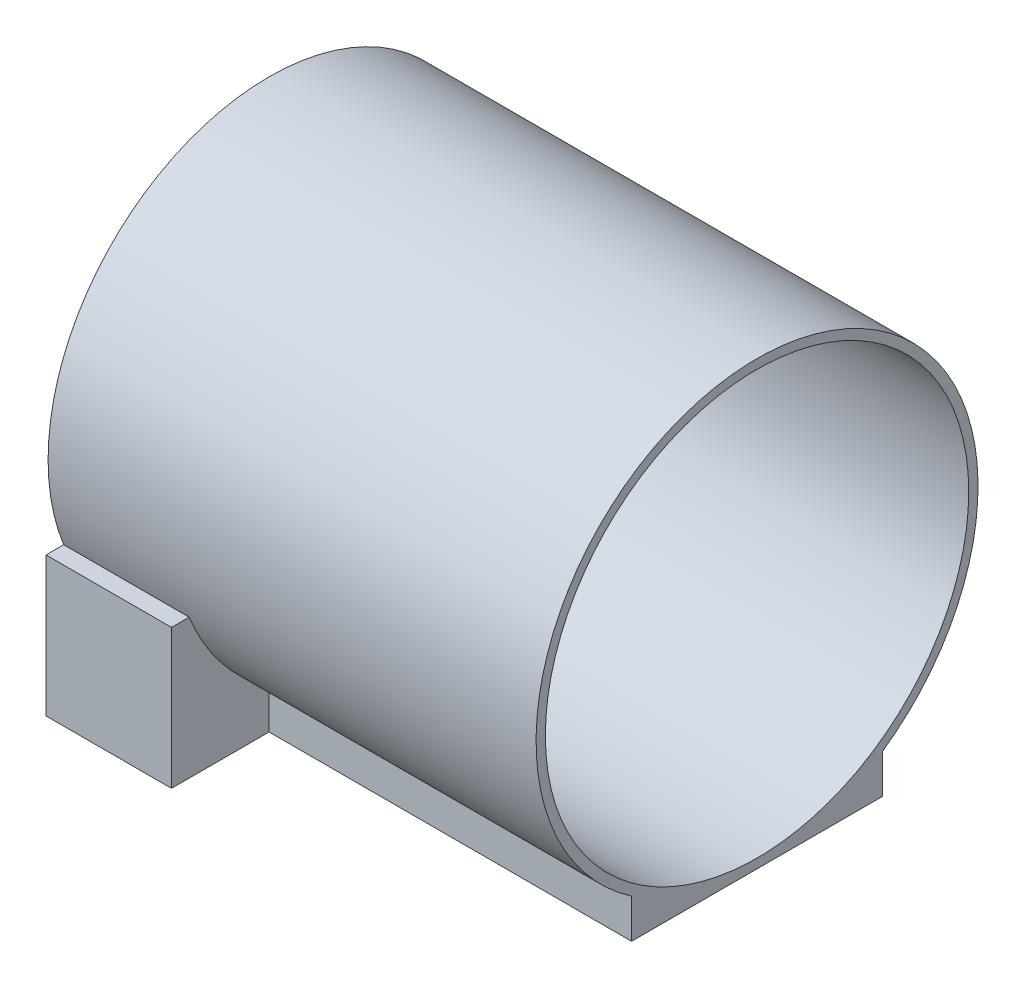
from build123d import *

# Parameters (mm, degrees)
SKETCH2_W                = 10
SKETCH2_H                = 86
BOSS_EXTRUDE1_DEPTH      = 10
SKETCH3_W                = 10
SKETCH3_H                = 86
BOSS_EXTRUDE2_DEPTH      = 23
BOSS_EXTRUDE3_REACH      = 246.16
BOSS_EXTRUDE4_DEPTH      = 100
BOSS_EXTRUDE4_DEPTH_BACK = 5
SKETCH5_R                = 47.55
SKETCH7_W                = 10
SKETCH7_H                = 18.447060317
BOSS_EXTRUDE6_DEPTH      = 30
CUT_EXTRUDE2_DEPTH       = 10
BOSS_EXTRUDE7_REACH      = 275.742
SKETCH6_R                = 45.55
CUT_EXTRUDE1_DEPTH       = 100
SKETCH10_W               = 15
SKETCH10_H               = 10
SKETCH10_W_2             = 10
SKETCH10_H_2             = 15
BOSS_EXTRUDE8_DEPTH      = 28.5
FILLET1_R                = 30
FILLET2_R                = 30
FILLET3_R                = 30
SKETCH11_W               = 250
SKETCH11_H               = 33
CUT_EXTRUDE3_DEPTH       = 234.52646531


with BuildPart() as part:
    # Sketch2 → Boss-Extrude1 (new body)
    with BuildSketch(Plane(origin=(0, 0, 0), x_dir=(1, 0, 0), z_dir=(0, 1, 0))):
        Polygon((-125, -75), (-115, -75), (-115, -48), (-47, -48), (-47, -75), (47, -75), (47, -48), (115, -48), (115, -75), (125, -75), (125, 75), (115, 75), (115, 48), (47, 48), (47, 75), (-47, 75), (-47, 48), (-115, 48), (-115, 75), (-125, 75), align=None)
        with Locations((-110, 0)):
            Rectangle(SKETCH2_W, SKETCH2_H, mode=Mode.SUBTRACT)
    extrude(amount=BOSS_EXTRUDE1_DEPTH)

    # Sketch3 → Boss-Extrude2 (add)
    with BuildSketch(Plane(origin=(0, 10, 0), x_dir=(1, 0, 0), z_dir=(0, 1, 0))):
        Polygon((-47, 48), (-47, 75), (47, 75), (47, 48), (26, 48), (26, 27), (93, 27), (93, 48), (115, 48), (115, 75), (125, 75), (125, -75), (115, -75), (115, -48), (93, -48), (93, -27), (26, -27), (26, -48), (47, -48), (47, -75), (-47, -75), (-47, -48), (-26, -48), (-26, -27), (-93, -27), (-93, -48), (-115, -48), (-115, -75), (-125, -75), (-125, 75), (-115, 75), (-115, 48), (-93, 48), (-93, 27), (-26, 27), (-26, 48), align=None)
        with Locations((-110, 0)):
            Rectangle(SKETCH3_W, SKETCH3_H, mode=Mode.SUBTRACT)
    extrude(amount=BOSS_EXTRUDE2_DEPTH)

    # Sketch4 → Boss-Extrude3 (add, up to next)
    with BuildSketch(Plane.ZY.offset(105), mode=Mode.PRIVATE) as boss_extrude3_sk1:
        Polygon((-43, 0), (-9.223530158, 14.703891082), (-43, 33), align=None)
    boss_extrude3_tool1 = extrude(boss_extrude3_sk1.sketch, amount=BOSS_EXTRUDE3_REACH, mode=Mode.PRIVATE) - part.part
    # Sketch4 → Boss-Extrude3 (add, up to next)
    with BuildSketch(Plane.ZY.offset(105), mode=Mode.PRIVATE) as boss_extrude3_sk2:
        Polygon((43, 0), (9.223530158, 14.703891082), (-24.552939683, 33), (43, 33), align=None)
    boss_extrude3_tool2 = extrude(boss_extrude3_sk2.sketch, amount=BOSS_EXTRUDE3_REACH, mode=Mode.PRIVATE) - part.part
    add(boss_extrude3_tool1.solids().sort_by_distance((-105, 15.901297, -31.741177))[0])
    add(boss_extrude3_tool2.solids().sort_by_distance((-105, 21.685197, 19.901194))[0])



with BuildPart() as body_2:
    # Sketch5 → Boss-Extrude4 (new, two sides: drawn at the far end of the back side and taken through both)
    with BuildSketch(Plane(origin=(-115, 0, 0), x_dir=(0, 0, -1), z_dir=(1, 0, 0)).offset(-BOSS_EXTRUDE4_DEPTH_BACK)):
        with Locations((0, 80.55)):
            Circle(SKETCH5_R)
    extrude(amount=BOSS_EXTRUDE4_DEPTH + BOSS_EXTRUDE4_DEPTH_BACK)


with BuildPart() as part_1:
    add(part.part)

    add(body_2.part)  # Boss-Extrude6 merges body 2
    # Sketch7 → Boss-Extrude6 (add)
    with BuildSketch(Plane(origin=(0, 33, 0), x_dir=(1, 0, 0), z_dir=(0, 1, 0))):
        Polygon((-120, 0), (-120, 48), (-93, 48), (-93, 27), (-15, 27), (-15, -27), (-93, -27), (-93, -48), (-120, -48), align=None)
        with Locations((-110, 33.776469842)):
            Rectangle(SKETCH7_W, SKETCH7_H, mode=Mode.SUBTRACT)
    extrude(amount=BOSS_EXTRUDE6_DEPTH)

    # Sketch8 → Cut-Extrude2 (cut)
    with BuildSketch(Plane.ZY.offset(105)):
        Polygon((-43, 46.626077643), (-41.871641374, 62.212018017), (-24.552939683, 62.212018017), (-24.552939683, 33), (-43, 33), align=None)
    extrude(amount=CUT_EXTRUDE2_DEPTH, mode=Mode.SUBTRACT)

    # Sketch9 → Boss-Extrude7 (add, up to next)
    with BuildSketch(Plane.ZY.offset(105), mode=Mode.PRIVATE) as boss_extrude7_sk1:
        Polygon((-42.138917347, 58.520153318), (-43, 46.626077643), (-43, 62.212018017), (-41.871641374, 62.212018017), align=None)
    boss_extrude7_tool1 = extrude(boss_extrude7_sk1.sketch, amount=BOSS_EXTRUDE7_REACH, mode=Mode.PRIVATE) - part_1.part
    add(boss_extrude7_tool1.solids().sort_by_distance((-105, 57.016705, -42.62388))[0])

    # Sketch6 → Cut-Extrude1 (cut)
    with BuildSketch(Plane(origin=(-15, 0, 0), x_dir=(0, 0, -1), z_dir=(1, 0, 0))):
        with Locations((0, 80.55)):
            Circle(SKETCH6_R)
    extrude(amount=-CUT_EXTRUDE1_DEPTH, mode=Mode.SUBTRACT)

    # Sketch10 → Boss-Extrude8 (add)
    with BuildSketch(Plane(origin=(0, 33, 0), x_dir=(1, 0, 0), z_dir=(0, 1, 0))):
        with Locations((12.5, 39)):
            Rectangle(SKETCH10_W, SKETCH10_H)
        with Locations((12.5, -39)):
            Rectangle(SKETCH10_W, SKETCH10_H)
        with Locations((63, 0)):
            Rectangle(SKETCH10_W_2, SKETCH10_H_2)
    extrude(amount=BOSS_EXTRUDE8_DEPTH)

    # Fillet1
    # the kernel refuses this fillet: 30 mm, written as the material it adds along each edge
    with BuildSketch(Plane(origin=(5, 33, 44), x_dir=(0, 0, 1), z_dir=(1, 0, 0))) as fillet1_piece_1:
        with BuildLine():
            CenterArc((29.962476533, -30), FILLET1_R, 90, 87.134016017)
            Line((0, -28.5), (0, 0))
            Line((0, 0), (29.962476533, 0))
        make_face()
    extrude(amount=15)

    # Fillet2
    # the kernel refuses this fillet: 30 mm, written as the material it adds along each edge
    with BuildSketch(Plane(origin=(20, 33, -44), x_dir=(0, 0, -1), z_dir=(-1, 0, 0))) as fillet2_piece_1:
        with BuildLine():
            CenterArc((29.962476533, -30), FILLET2_R, 90, 87.134016017)
            Line((0, -28.5), (0, 0))
            Line((0, 0), (29.962476533, 0))
        make_face()
    extrude(amount=15)

    # Fillet3
    # the kernel refuses this fillet: 30 mm, written as the material it adds along each edge
    with BuildSketch(Plane(origin=(68, 33, 7.5), x_dir=(1, 0, 0), z_dir=(0, 0, -1))) as fillet3_piece_1:
        with BuildLine():
            CenterArc((29.962476533, -30), FILLET3_R, 90, 87.134016017)
            Line((0, -28.5), (0, 0))
            Line((0, 0), (29.962476533, 0))
        make_face()
    extrude(amount=15)

    # Sketch11 → Cut-Extrude3 (cut, through all)
    with BuildSketch(Plane.XY.offset(75)):
        with Locations((0, 16.5)):
            Rectangle(SKETCH11_W, SKETCH11_H)
    extrude(amount=-CUT_EXTRUDE3_DEPTH, mode=Mode.SUBTRACT)


with BuildPart() as cut_extrude3_piece_1:
    # of the separate pieces the step leaves, piece 1, a body of its own (cut_extrude3_pieces)
    add(part_1.part.solids().sort_by_distance((-93, 33, 27))[0])


with BuildPart() as cut_extrude3_piece_2:
    # of the separate pieces the step leaves, piece 2, a body of its own (cut_extrude3_pieces)
    add(part_1.part.solids().sort_by_distance((97.962476533, 33, 7.5))[0])


with BuildPart() as cut_extrude3_piece_3:
    # of the separate pieces the step leaves, piece 3, a body of its own (cut_extrude3_pieces)
    add(part_1.part.solids().sort_by_distance((20, 33, 34))[0])


with BuildPart() as cut_extrude3_piece_4:
    # of the separate pieces the step leaves, piece 4, a body of its own (cut_extrude3_pieces)
    add(part_1.part.solids().sort_by_distance((20, 33, -73.962476533))[0])


solid = cut_extrude3_piece_1.part
